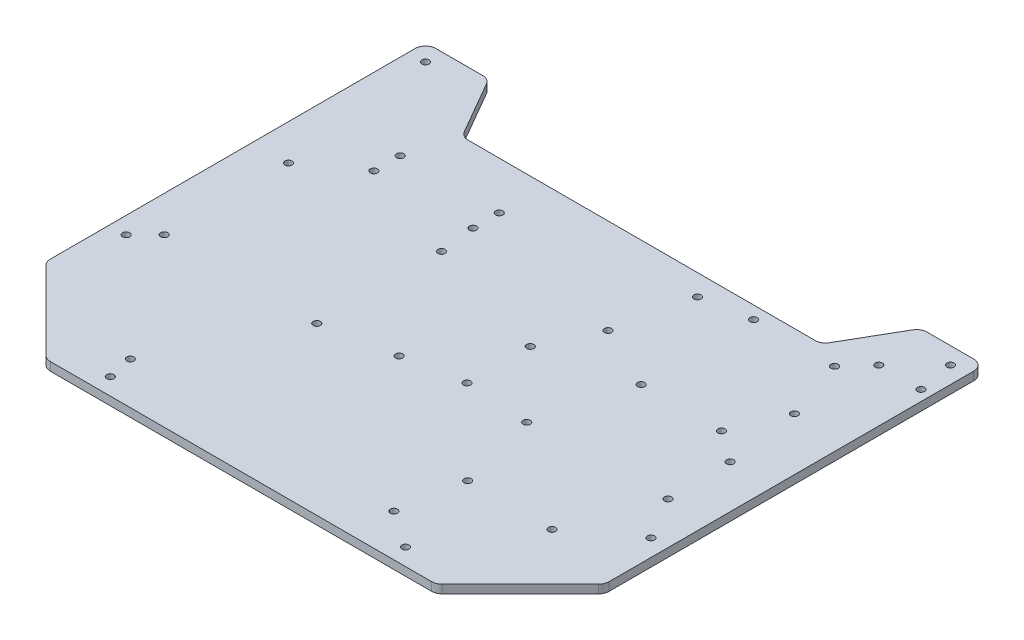
from build123d import *

# Parameters (mm, degrees)
MAIN_EXTRUSION_DEPTH    = 4
CONG_1_R                = 5
ESQUISSE1_R             = 1
ENL_V_MAT_EXTRU_1_DEPTH = 257.850637531
D_GAGEMENT_M31_D        = 3.4
ESQUISSE4_R             = 1
ENL_V_MAT_EXTRU_2_DEPTH = 257.850637531
D_GAGEMENT_M32_D        = 3.4


with BuildPart() as part:
    # Main scetch → Main extrusion (new body)
    with BuildSketch(Plane(origin=(0, 0, 0), x_dir=(1, 0, 0), z_dir=(0, 1, 0))):
        Polygon((-92.5, 0), (92.5, 0), (132.5, 40), (132.5, 220), (102.5, 220), (85.179491924, 190), (-85.179491924, 190), (-102.5, 220), (-132.5, 220), (-132.5, 40), align=None)
    extrude(amount=MAIN_EXTRUSION_DEPTH)

    # Congé1
    cong_1_edges = [part.edges().sort_by_distance(p)[0] for p in [
        (-132.5, 2, -40),
        (-92.5, 2, 0),
        (92.5, 2, 0),
        (132.5, 2, -40),
        (132.5, 2, -220),
        (102.5, 2, -220),
        (85.179491924, 2, -190),
        (-85.179491924, 2, -190),
        (-102.5, 2, -220),
        (-132.5, 2, -220),
    ]]
    fillet(cong_1_edges, radius=CONG_1_R)

    # Esquisse1 → Enlèv. mat.-Extru.1 (cut, through all)
    with BuildSketch(Plane(origin=(0, 4, 0), x_dir=(1, 0, 0), z_dir=(0, 1, 0))):
        with Locations((70, 8)):
            Circle(ESQUISSE1_R)
        with Locations((124.5, 70)):
            Circle(ESQUISSE1_R)
        with Locations((124.5, 212)):
            Circle(ESQUISSE1_R)
        with Locations((-124.5, 212)):
            Circle(ESQUISSE1_R)
        with Locations((-124.5, 70)):
            Circle(ESQUISSE1_R)
        with Locations((-70, 8)):
            Circle(ESQUISSE1_R)
    extrude(amount=-ENL_V_MAT_EXTRU_1_DEPTH, mode=Mode.SUBTRACT)

    # Dégagement M31 (through all)
    with Locations(Plane(origin=(0, 4, 0), x_dir=(1, 0, 0), z_dir=(0, 1, 0))):
        with Locations((-124.5, 212), (-124.5, 70), (-70, 8), (70, 8), (124.5, 70), (124.5, 212)):
            Hole(D_GAGEMENT_M31_D / 2)

    # Esquisse4 → Enlèv. mat.-Extru.2 (cut, through all)
    with BuildSketch(Plane(origin=(0, 4, 0), x_dir=(1, 0, 0), z_dir=(0, 1, 0))):
        with Locations((36.5, 180)):
            Circle(ESQUISSE4_R)
        with Locations((29.12, 145)):
            Circle(ESQUISSE4_R)
        with Locations((107.5, 155)):
            Circle(ESQUISSE4_R)
        with Locations((127.5, 195)):
            Circle(ESQUISSE4_R)
        with Locations((112, 120)):
            Circle(ESQUISSE4_R)
        with Locations((112.5, 90)):
            Circle(ESQUISSE4_R)
        with Locations((17.2, 120)):
            Circle(ESQUISSE4_R)
        with Locations((17.2, 90)):
            Circle(ESQUISSE4_R)
        with Locations((47.5, 88)):
            Circle(ESQUISSE4_R)
        with Locations((57.5, 50)):
            Circle(ESQUISSE4_R)
        with Locations((97.5, 50)):
            Circle(ESQUISSE4_R)
        with Locations((52.5, 20)):
            Circle(ESQUISSE4_R)
        with Locations((-10, 85)):
            Circle(ESQUISSE4_R)
        with Locations((-72.5, 20)):
            Circle(ESQUISSE4_R)
        with Locations((107.5, 195)):
            Circle(ESQUISSE4_R)
        with Locations((-115.5, 138)):
            Circle(ESQUISSE4_R)
        with Locations((-42.86, 138)):
            Circle(ESQUISSE4_R)
        with Locations((-115.5, 79.07)):
            Circle(ESQUISSE4_R)
        with Locations((-42.890430383, 78.82)):
            Circle(ESQUISSE4_R)
        with Locations((-92, 167.5)):
            Circle(ESQUISSE4_R)
        with Locations((-45, 167.5)):
            Circle(ESQUISSE4_R)
        with Locations((-92, 155)):
            Circle(ESQUISSE4_R)
        with Locations((-45, 155)):
            Circle(ESQUISSE4_R)
        with Locations((59.15, 184)):
            Circle(ESQUISSE4_R)
        with Locations((97.5, 184)):
            Circle(ESQUISSE4_R)
        with Locations((59.15, 130.66)):
            Circle(ESQUISSE4_R)
        with Locations((97.25, 130.66)):
            Circle(ESQUISSE4_R)
    extrude(amount=-ENL_V_MAT_EXTRU_2_DEPTH, mode=Mode.SUBTRACT)

    # Dégagement M32 (through all)
    with Locations(Plane(origin=(0, 4, 0), x_dir=(1, 0, 0), z_dir=(0, 1, 0))):
        with Locations((17.2, 120), (29.12, 145), (36.5, 180), (107.5, 155), (127.5, 195), (112, 120), (112.5, 90), (47.5, 88), (17.2, 90), (57.5, 50), (97.5, 50), (-10, 85), (-72.5, 20), (52.5, 20), (107.5, 195), (-115.5, 138), (-42.86, 138), (-115.5, 79.07), (-42.890430383, 78.82), (-92, 167.5), (-92, 155), (-45, 155), (-45, 167.5), (59.15, 184), (97.5, 184), (59.15, 130.66), (97.25, 130.66)):
            Hole(D_GAGEMENT_M32_D / 2)


solid = part.part
